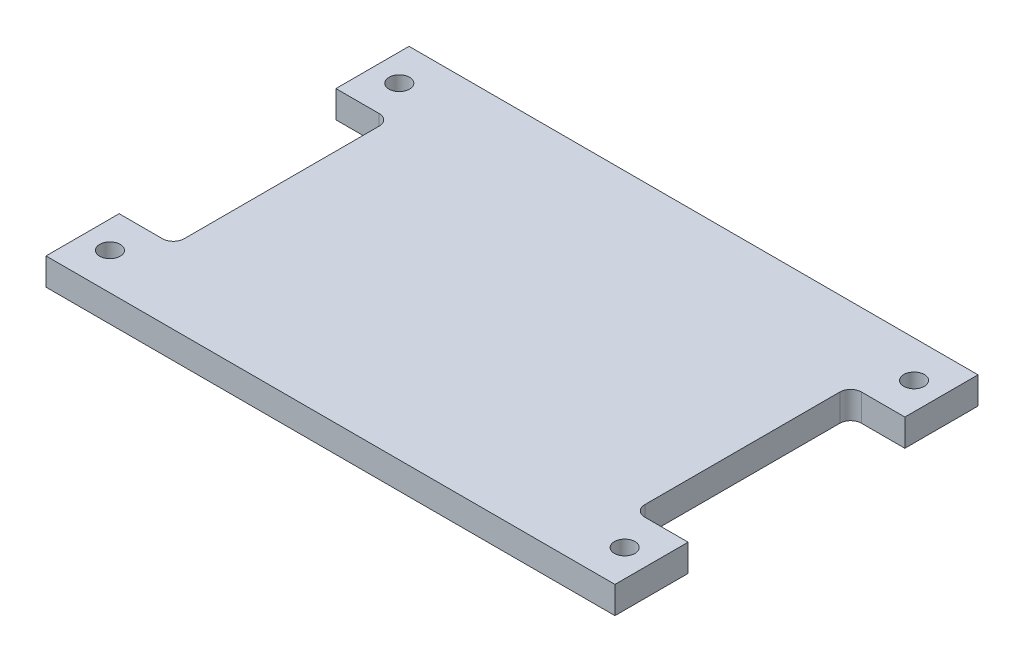
from build123d import *

# Parameters (mm, degrees)
SKETCH1_W           = 133.35
SKETCH1_H           = 85.09
BOSS_EXTRUDE1_DEPTH = 6.35
SKETCH4_W           = 12.7
SKETCH4_H           = 50.8
CUT_EXTRUDE8_DEPTH  = 101.417876049
SKETCH2_R           = 2.413
CUT_EXTRUDE1_DEPTH  = 101.417876049
FILLET1_R           = 2.54


with BuildPart() as part:
    # Sketch1 → Boss-Extrude1 (new body)
    with BuildSketch(Plane(origin=(0, 0, 0), x_dir=(1, 0, 0), z_dir=(0, 1, 0))):
        with Locations((21.486627907, 5.109534884)):
            Rectangle(SKETCH1_W, SKETCH1_H)
    extrude(amount=BOSS_EXTRUDE1_DEPTH)

    # Sketch4 → Cut-Extrude8 (cut, through all)
    with BuildSketch(Plane(origin=(0, 6.35, 0), x_dir=(1, 0, 0), z_dir=(0, 1, 0))):
        with Locations((81.811627907, 5.109534884)):
            Rectangle(SKETCH4_W, SKETCH4_H)
        with Locations((-38.838372093, 5.109534884)):
            Rectangle(SKETCH4_W, SKETCH4_H)
    extrude(amount=-CUT_EXTRUDE8_DEPTH, mode=Mode.SUBTRACT)

    # Sketch2 → Cut-Extrude1 (cut, through all)
    with BuildSketch(Plane(origin=(0, 6.35, 0), x_dir=(1, 0, 0), z_dir=(0, 1, 0))):
        with Locations((81.811627907, -28.799465116)):
            Circle(SKETCH2_R)
        with Locations((81.811627907, 39.018534884)):
            Circle(SKETCH2_R)
        with Locations((-38.838372093, 39.018534884)):
            Circle(SKETCH2_R)
        with Locations((-38.838372093, -28.799465116)):
            Circle(SKETCH2_R)
    extrude(amount=-CUT_EXTRUDE1_DEPTH, mode=Mode.SUBTRACT)

    # Fillet1
    fillet1_edges = [part.edges().sort_by_distance(p)[0] for p in [
        (75.461627907, 3.175, -30.509534884),
        (75.461627907, 3.175, 20.290465116),
        (-32.488372093, 3.175, 20.290465116),
        (-32.488372093, 3.175, -30.509534884),
    ]]
    fillet(fillet1_edges, radius=FILLET1_R)


solid = part.part
